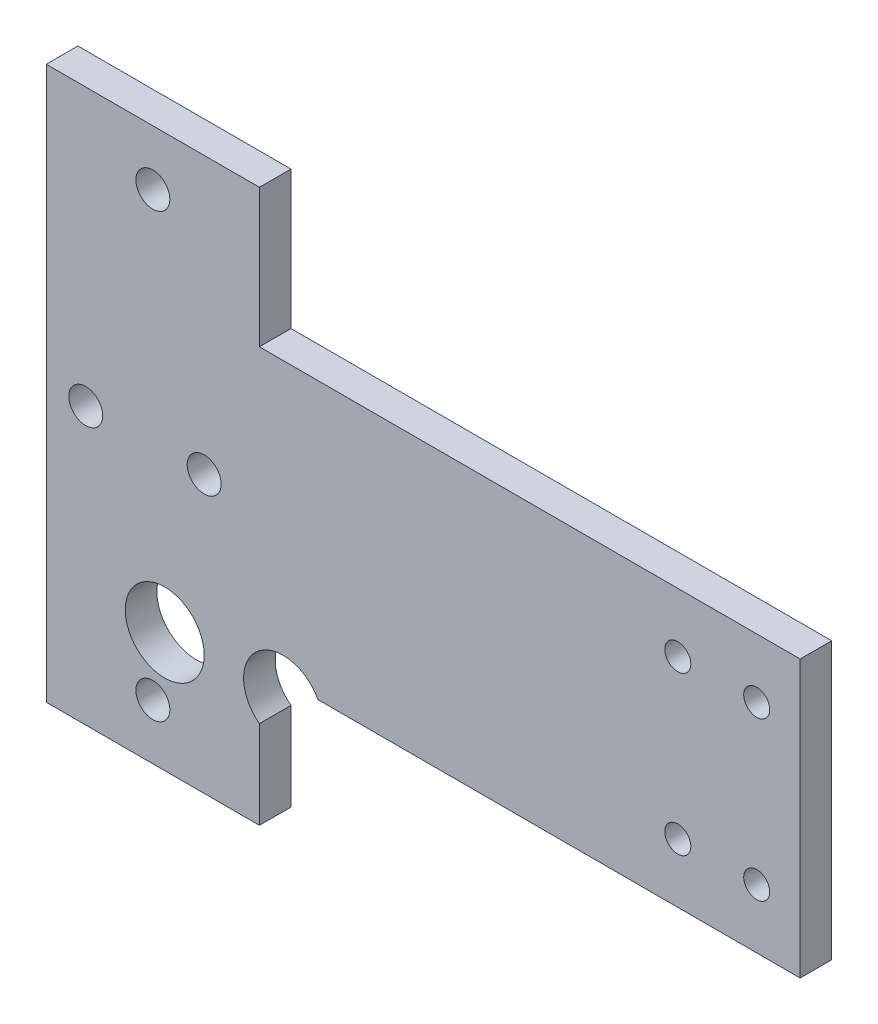
from build123d import *

# Parameters (mm, degrees)
SKETCH_1_W          = 100
SKETCH_1_H          = 35
EXTRUDE_1_DEPTH     = 4
SKETCH_2_R          = 1.65
CUT_EXTRUDE_1_DEPTH = 107.023582282
SKETCH_4_R          = 2.15
CUT_EXTRUDE_3_DEPTH = 107.023582282
SKETCH_8_W          = 27
SKETCH_8_H          = 70
SKETCH_8_R          = 2.15
EXTRUDE_2_DEPTH     = 4
SKETCH_9_R          = 5
CUT_EXTRUDE_6_DEPTH = 4
SKETCH_10_R         = 1.65
CUT_EXTRUDE_7_DEPTH = 10
SKETCH_11_W         = 4.5
SKETCH_11_H         = 35
CUT_EXTRUDE_8_DEPTH = 10


with BuildPart() as part:
    # 草图1 → 凸台-拉伸1 (new body)
    with BuildSketch(Plane.XY):
        with Locations((50, -17.5)):
            Rectangle(SKETCH_1_W, SKETCH_1_H)
    extrude(amount=EXTRUDE_1_DEPTH)

    # 草图2 → 切除-拉伸1 (cut, through all)
    with BuildSketch(Plane.XY.offset(4)):
        with Locations((80, -7.5)):
            Circle(SKETCH_2_R)
        with Locations((80, -27.5)):
            Circle(SKETCH_2_R)
    extrude(amount=-CUT_EXTRUDE_1_DEPTH, mode=Mode.SUBTRACT)

    # 草图4 → 切除-拉伸3 (cut, through all)
    with BuildSketch(Plane.XY.offset(4)):
        with Locations((5, -17.5)):
            Circle(SKETCH_4_R)
        with Locations((20, -17.5)):
            Circle(SKETCH_4_R)
    extrude(amount=-CUT_EXTRUDE_3_DEPTH, mode=Mode.SUBTRACT)

    # 草图8 → 凸台-拉伸2 (add)
    with BuildSketch(Plane.XY.offset(4)):
        with Locations((13.5, -17.5)):
            Rectangle(SKETCH_8_W, SKETCH_8_H)
        with Locations((13.5, 10.5)):
            Circle(SKETCH_8_R, mode=Mode.SUBTRACT)
        with Locations((13.5, -45.5)):
            Circle(SKETCH_8_R, mode=Mode.SUBTRACT)
        with Locations((5, -17.5)):
            Circle(SKETCH_8_R, mode=Mode.SUBTRACT)
        with Locations((20, -17.5)):
            Circle(SKETCH_8_R, mode=Mode.SUBTRACT)
    extrude(amount=-EXTRUDE_2_DEPTH)

    # 草图9 → 切除-拉伸6 (cut)
    with BuildSketch(Plane.XY.offset(4)):
        with Locations((30, -37.34)):
            Circle(SKETCH_9_R)
        with Locations((15, -37.34)):
            Circle(SKETCH_9_R)
    extrude(amount=-CUT_EXTRUDE_6_DEPTH, mode=Mode.SUBTRACT)

    # 草图10 → 切除-拉伸7 (cut)
    with BuildSketch(Plane.XY.offset(4)):
        with Locations((90, -7.5)):
            Circle(SKETCH_10_R)
        with Locations((90, -27.5)):
            Circle(SKETCH_10_R)
    extrude(amount=-CUT_EXTRUDE_7_DEPTH, mode=Mode.SUBTRACT)

    # 草图11 → 切除-拉伸8 (cut)
    with BuildSketch(Plane.XY.offset(4)):
        with Locations((97.75, -17.5)):
            Rectangle(SKETCH_11_W, SKETCH_11_H)
    extrude(amount=-CUT_EXTRUDE_8_DEPTH, mode=Mode.SUBTRACT)


solid = part.part
